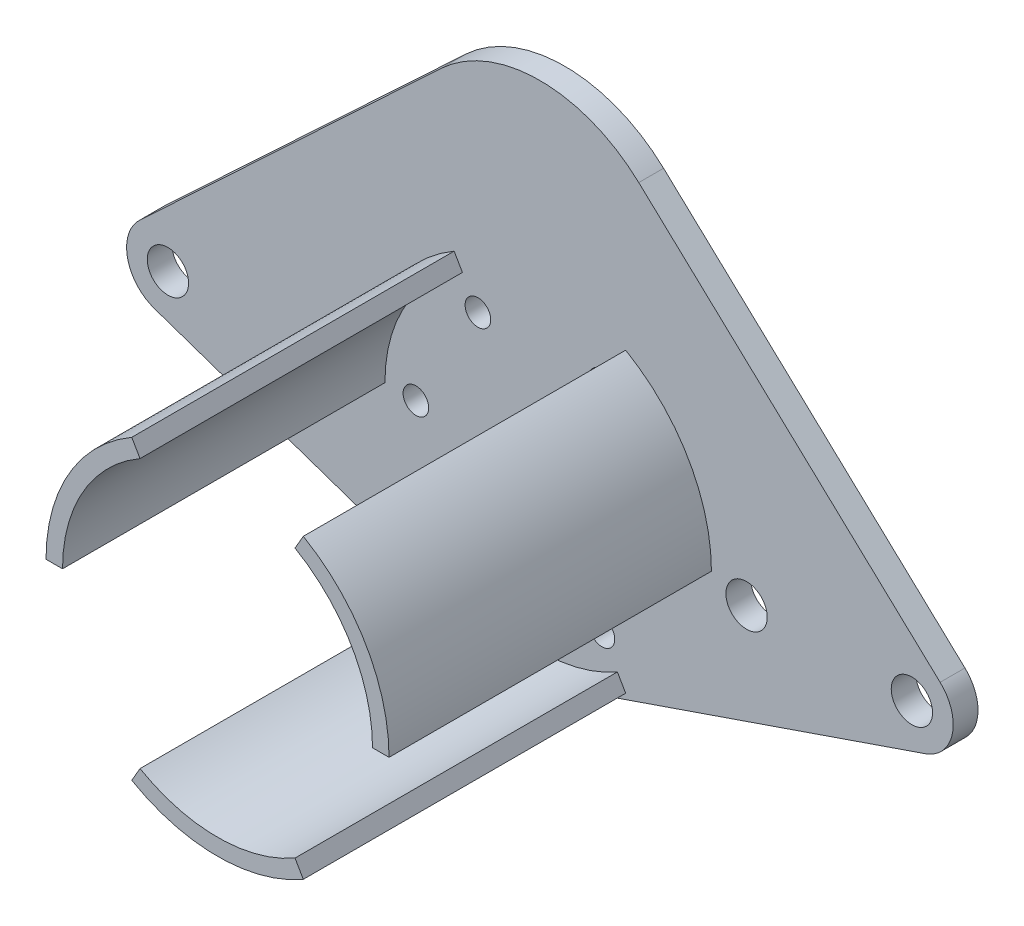
from build123d import *

# Parameters (mm, degrees)
SKETCH1_R           = 2.5
SKETCH1_R_2         = 6.1
SKETCH1_R_3         = 1.55
BOSS_EXTRUDE1_DEPTH = 3
BOSS_EXTRUDE2_DEPTH = 39


with BuildPart() as part:
    # Sketch1 → Boss-Extrude1 (new body)
    with BuildSketch(Plane.XY):
        with BuildLine():
            Line((-46.62493921, -4.72859097), (-6.82474468, -18.405582076))
            ThreePointArc((-6.82474468, -18.405582076), (0, -19.5455), (6.82474468, -18.405582076))
            Line((6.82474468, -18.405582076), (46.62493921, -4.72859097))
            ThreePointArc((46.62493921, -4.72859097), (49.889437912, -1.045656207), (48.416861363, 3.650350453))
            Line((48.416861363, 3.650350453), (11.959014769, 37.776226585))
            ThreePointArc((11.959014769, 37.776226585), (0, 42.5), (-11.959014769, 37.776226585))
            Line((-11.959014769, 37.776226585), (-48.416861363, 3.650350453))
            ThreePointArc((-48.416861363, 3.650350453), (-49.889437912, -1.045656207), (-46.62493921, -4.72859097))
        make_face()
        with Locations((-25, 0)):
            Circle(SKETCH1_R, mode=Mode.SUBTRACT)
        with Locations((0, -5.5455)):
            Circle(SKETCH1_R_2, mode=Mode.SUBTRACT)
        with Locations((-7.5, 14.444881057)):
            Circle(SKETCH1_R_3, mode=Mode.SUBTRACT)
        with Locations((-15, 1.4545)):
            Circle(SKETCH1_R_3, mode=Mode.SUBTRACT)
        with Locations((-7.5, -11.535881057)):
            Circle(SKETCH1_R_3, mode=Mode.SUBTRACT)
        with Locations((7.5, -11.535881057)):
            Circle(SKETCH1_R_3, mode=Mode.SUBTRACT)
        with Locations((7.5, 14.444881057)):
            Circle(SKETCH1_R_3, mode=Mode.SUBTRACT)
        with Locations((15, 1.4545)):
            Circle(SKETCH1_R_3, mode=Mode.SUBTRACT)
        with Locations((25, 0)):
            Circle(SKETCH1_R, mode=Mode.SUBTRACT)
        with Locations((-45, 0)):
            Circle(SKETCH1_R, mode=Mode.SUBTRACT)
        with Locations((45, 0)):
            Circle(SKETCH1_R, mode=Mode.SUBTRACT)
    extrude(amount=BOSS_EXTRUDE1_DEPTH)

    # Sketch2 → Boss-Extrude2 (add)
    with BuildSketch(Plane.XY.offset(3)):
        with BuildLine():
            Line((-9.375, 17.692476321), (-10.375, 19.424527129))
            ThreePointArc((-10.375, 19.424527129), (-17.970027129, 11.8295), (-20.75, 1.4545))
            Line((-20.75, 1.4545), (-18.75, 1.4545))
            ThreePointArc((-18.75, 1.4545), (-16.237976321, 10.8295), (-9.375, 17.692476321))
        make_face()
        with BuildLine():
            Line((-9.375, -14.783476321), (-10.375, -16.515527129))
            ThreePointArc((-10.375, -16.515527129), (0, -19.2955), (10.375, -16.515527129))
            Line((10.375, -16.515527129), (9.375, -14.783476321))
            ThreePointArc((9.375, -14.783476321), (0, -17.2955), (-9.375, -14.783476321))
        make_face()
        with BuildLine():
            ThreePointArc((20.75, 1.4545), (17.970027129, 11.8295), (10.375, 19.424527129))
            Line((10.375, 19.424527129), (9.375, 17.692476321))
            ThreePointArc((9.375, 17.692476321), (16.237976321, 10.8295), (18.75, 1.4545))
            Line((18.75, 1.4545), (20.75, 1.4545))
        make_face()
    extrude(amount=BOSS_EXTRUDE2_DEPTH)


solid = part.part
